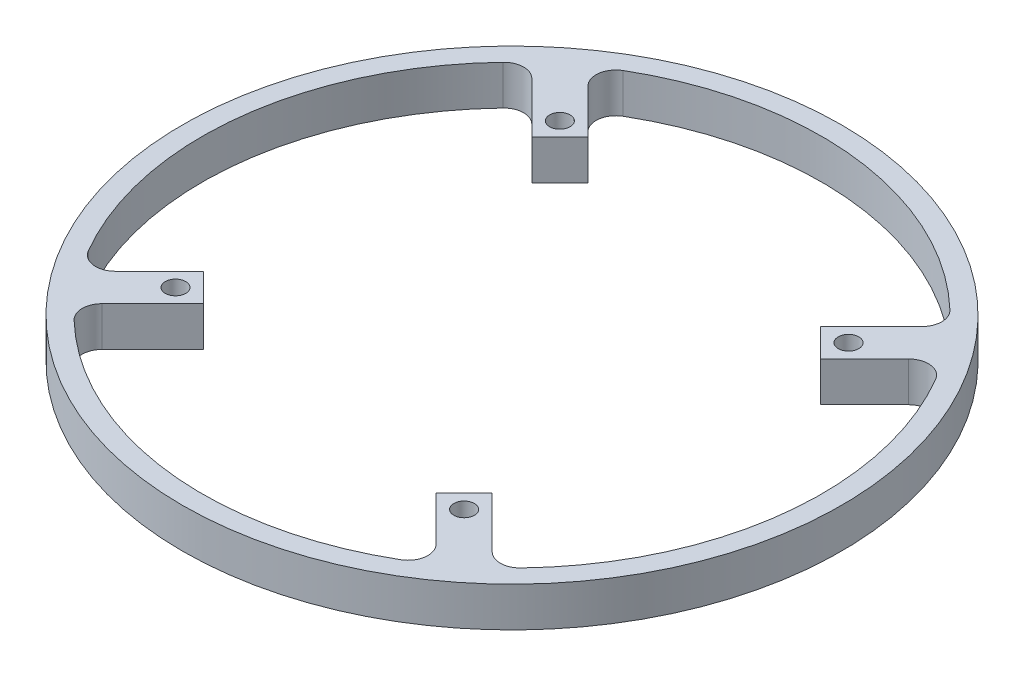
from build123d import *

# Parameters (mm, degrees)
SKETCH2_W                  = 28.09991
SKETCH2_H                  = 10
F_6_0_204_DIAMETER_HOLE1_D = 5.1816
CUT_EXTRUDE1_DEPTH         = 118.945708205
CIRPATTERN1_COUNT          = 4
FILLET1_R                  = 5


with BuildPart() as part:
    # Sketch2 → Revolve1 (revolve)
    with BuildSketch(Plane(origin=(0, 0, 0), x_dir=(0, 0, -1), z_dir=(1, 0, 0))):
        with Locations((-69.049955, 5)):
            Rectangle(SKETCH2_W, SKETCH2_H)
    revolve(axis=Axis((0, 3.678923398, 0), (0, 1, 0)))

    # #6 (0.204) Diameter Hole1 (through all)
    with Locations(Plane(origin=(0, 0, 0), x_dir=(-1, 0, 0), z_dir=(0, -1, 0))):
        with Locations((36.390872965, 48.461940777)):
            f_6_0_204_diameter_hole1 = Hole(F_6_0_204_DIAMETER_HOLE1_D / 2)

    # Sketch14 → Cut-Extrude1 (cut, through all)
    with BuildSketch(Plane.XZ):
        with BuildLine():
            Line((-33.070789849, -38.070789849), (-52.668360235, -57.668360235))
            ThreePointArc((-52.668360235, -57.668360235), (-77.63013018, -8.553293534), (-63.960337268, 44.818201644))
            Line((-63.960337268, 44.818201644), (-55.533008589, 36.390872965))
            Line((-55.533008589, 36.390872965), (-48.461940777, 29.319805153))
            Line((-48.461940777, 29.319805153), (-41.390872965, 36.390872965))
            Line((-41.390872965, 36.390872965), (-38.070789849, 33.070789849))
            ThreePointArc((-38.070789849, 33.070789849), (-50.304693428, -3.535533906), (-33.070789849, -38.070789849))
        make_face()
    cut_extrude1 = extrude(amount=-CUT_EXTRUDE1_DEPTH, mode=Mode.SUBTRACT)

    # CirPattern1: #6 (0.204) Diameter Hole1, Cut-Extrude1 ×4 about axis
    cirpattern1_axis = Axis((0, 3.678923398, 0), (0, 1, 0))
    add([f_6_0_204_diameter_hole1.rotate(cirpattern1_axis, i * 360 / CIRPATTERN1_COUNT) for i in range(1, CIRPATTERN1_COUNT)], mode=Mode.SUBTRACT)
    add([cut_extrude1.rotate(cirpattern1_axis, i * 360 / CIRPATTERN1_COUNT) for i in range(1, CIRPATTERN1_COUNT)], mode=Mode.SUBTRACT)

    # Fillet1
    fillet1_edges = [part.edges().sort_by_distance(p)[0] for p in [
        (52.668360235, 5, 57.668360235),
        (-52.668360235, 5, -57.668360235),
        (57.668360235, 5, -52.668360235),
        (-57.668360235, 5, 52.668360235),
        (44.818201644, 5, 63.960337268),
        (63.960337268, 5, -44.818201644),
        (-44.818201644, 5, -63.960337268),
        (-63.960337268, 5, 44.818201644),
    ]]
    fillet(fillet1_edges, radius=FILLET1_R)


solid = part.part
